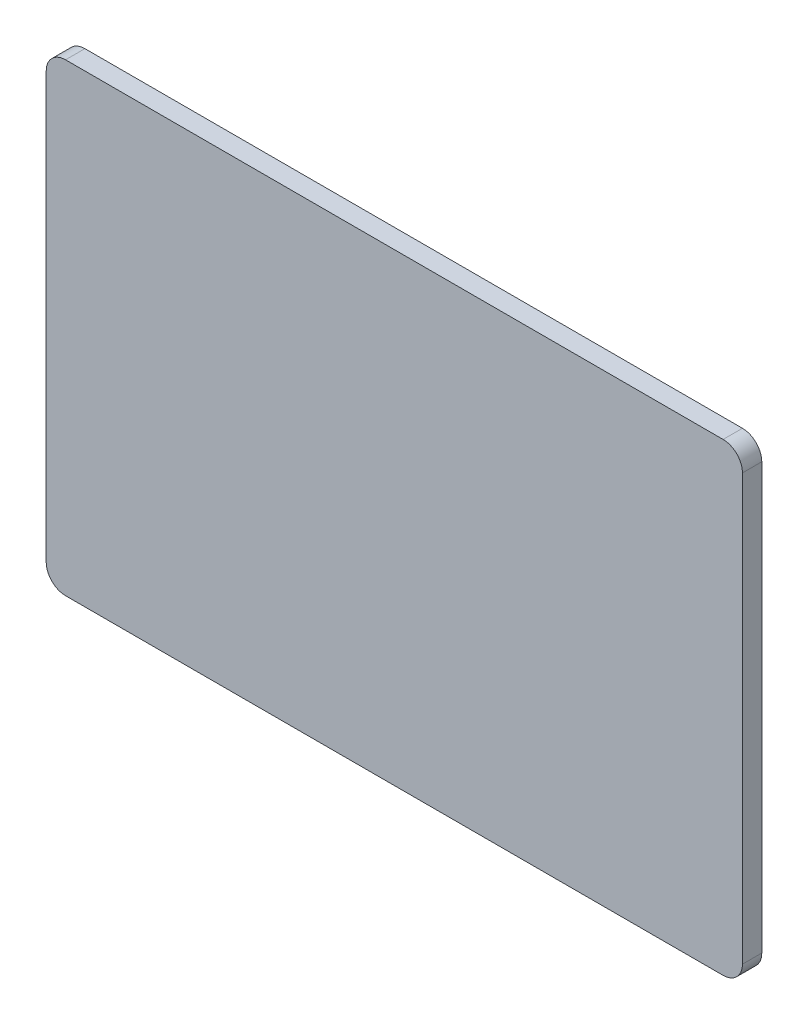
from build123d import *

# Parameters (mm, degrees)
SKETCH1_W           = 114.3
SKETCH1_H           = 76.2
BOSS_EXTRUDE1_DEPTH = 3.175
FILLET1_R           = 3.175


with BuildPart() as part:
    # Sketch1 → Boss-Extrude1 (new body)
    with BuildSketch(Plane.XY):
        with Locations((57.15, 38.1)):
            Rectangle(SKETCH1_W, SKETCH1_H)
    extrude(amount=BOSS_EXTRUDE1_DEPTH)

    # Fillet1
    fillet1_edges = [part.edges().sort_by_distance(p)[0] for p in [
        (0, 0, 1.5875),
        (0, 76.2, 1.5875),
        (114.3, 76.2, 1.5875),
        (114.3, 0, 1.5875),
    ]]
    fillet(fillet1_edges, radius=FILLET1_R)


solid = part.part
